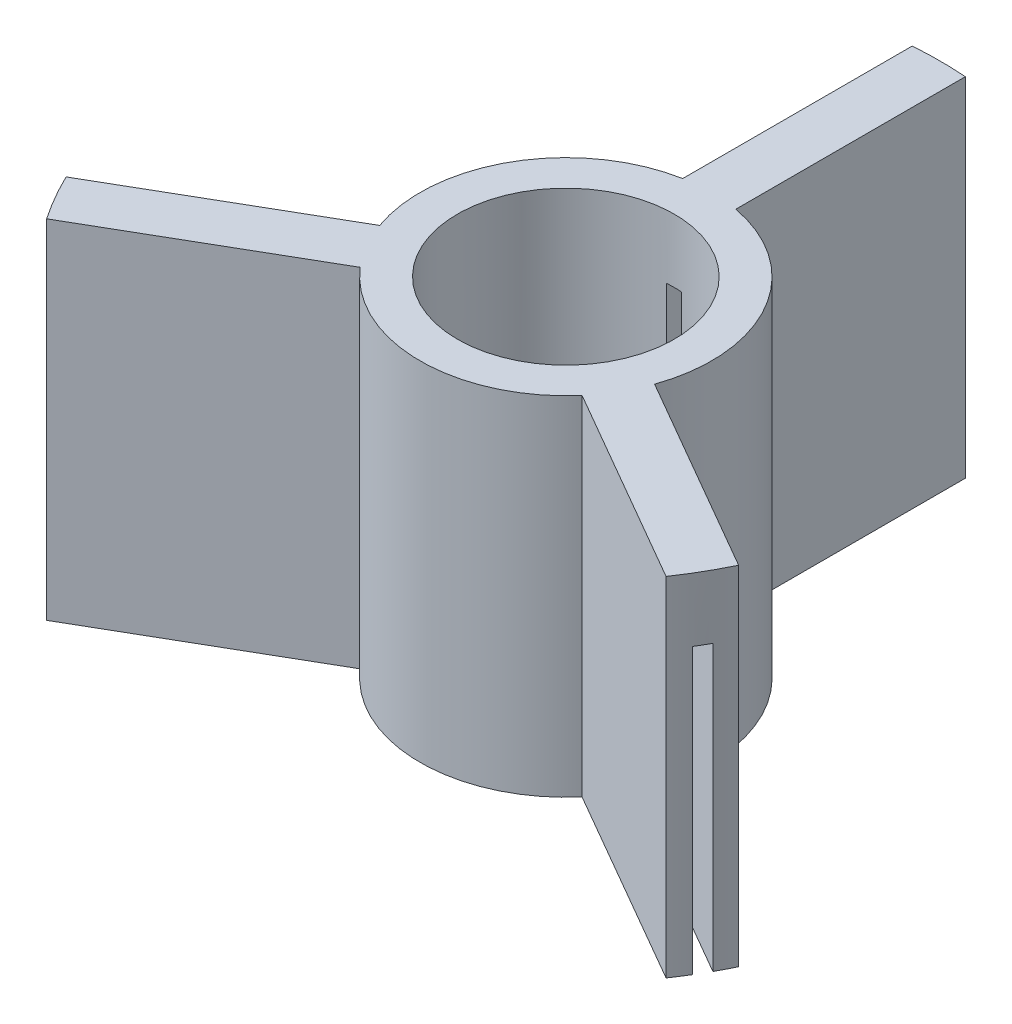
from build123d import *
from build123d.topology import SkipClean

# Parameters (mm, degrees)
BOSS_EXTRUDE1_DEPTH     = 93
SKETCH1_4_R             = 39
SKETCH1_4_R_2           = 29
EXTRUDE_THIN1_DEPTH     = 93
CUT_EXTRUDE_THIN1_DEPTH = 76


# Read off the part's stored shape, not the designer's step: Cut-Extrude-Thin1
with BuildPart() as part:
    # Sketch1 → Boss-Extrude1 (new body)
    with BuildSketch(Plane(origin=(0, 0, 0), x_dir=(1, 0, 0), z_dir=(0, 1, 0))):
        with BuildLine():
            Line((-86.602540378, -50), (-25.11473671, -14.5))
            ThreePointArc((-25.11473671, -14.5), (-26.712107385, -11.289965415), (-27.901144427, -7.907347195))
            Line((-27.901144427, -7.907347195), (-89.935126387, -43.722683378))
            ThreePointArc((-89.935126387, -43.722683378), (-88.324617875, -46.890957308), (-86.602540378, -50))
        make_face()
        with BuildLine():
            ThreePointArc((-20.798535761, -20.209426271), (-23.133450549, -17.488380876), (-25.11473671, -14.5))
            Line((-25.11473671, -14.5), (-86.602540378, -50))
            ThreePointArc((-86.602540378, -50), (-84.771069174, -53.045884205), (-82.83251772, -56.024762455))
            Line((-82.83251772, -56.024762455), (-20.798535761, -20.209426271))
        make_face()
        with BuildLine():
            ThreePointArc((27.901144427, -7.907347195), (26.712107385, -11.289965415), (25.11473671, -14.5))
            Line((25.11473671, -14.5), (86.602540378, -50))
            ThreePointArc((86.602540378, -50), (88.324617875, -46.890957308), (89.935126387, -43.722683378))
            Line((89.935126387, -43.722683378), (27.901144427, -7.907347195))
        make_face()
        with BuildLine():
            Line((86.602540378, -50), (25.11473671, -14.5))
            ThreePointArc((25.11473671, -14.5), (23.133450549, -17.488380876), (20.798535761, -20.209426271))
            Line((20.798535761, -20.209426271), (82.83251772, -56.024762455))
            ThreePointArc((82.83251772, -56.024762455), (84.771069174, -53.045884205), (86.602540378, -50))
        make_face()
        with BuildLine():
            ThreePointArc((-7.102608667, 28.116773466), (-3.578656835, 28.778346291), (0, 29))
            Line((0, 29), (0, 100))
            ThreePointArc((0, 100), (-3.553548701, 99.936841513), (-7.102608667, 99.747445833))
            Line((-7.102608667, 99.747445833), (-7.102608667, 28.116773466))
        make_face()
        with BuildLine():
            Line((0, 100), (0, 29))
            ThreePointArc((0, 29), (3.578656835, 28.778346291), (7.102608667, 28.116773466))
            Line((7.102608667, 28.116773466), (7.102608667, 99.747445833))
            ThreePointArc((7.102608667, 99.747445833), (3.553548701, 99.936841513), (0, 100))
        make_face()
    extrude(amount=BOSS_EXTRUDE1_DEPTH)

    # Sketch1<4> → Extrude-Thin1 (add)
    with SkipClean():  # the faces are left unmerged after this step: merging them gives an invalid solid
        with BuildSketch(Plane(origin=(0, 0, 0), x_dir=(1, 0, 0), z_dir=(0, 1, 0))):
            Circle(SKETCH1_4_R)
            Circle(SKETCH1_4_R_2, mode=Mode.SUBTRACT)
        extrude(amount=EXTRUDE_THIN1_DEPTH)

    # Cut-Extrude-Thin1 outline → Cut-Extrude-Thin1 (cut)
    with SkipClean():  # the faces are left unmerged after this step: merging them gives an invalid solid
        with BuildSketch(Plane(origin=(0, 0, 0), x_dir=(1, 0, 0), z_dir=(0, 1, 0))):
            with BuildLine():
                Line((2, 28.930952283), (2, 99.979998))
                ThreePointArc((2, 99.979998), (0, 100), (-2, 99.979998))
                Line((-2, 99.979998), (-2, 28.930952283))
                ThreePointArc((-2, 28.930952283), (0, 29), (2, 28.930952283))
            make_face()
            with BuildLine():
                Line((87.585218138, -48.257948192), (26.054939633, -12.733425334))
                ThreePointArc((26.054939633, -12.733425334), (25.11473671, -14.5), (24.054939633, -16.197526949))
                Line((24.054939633, -16.197526949), (85.585218138, -51.722049807))
                ThreePointArc((85.585218138, -51.722049807), (86.602540378, -50), (87.585218138, -48.257948192))
            make_face()
            with BuildLine():
                ThreePointArc((-24.054939633, -16.197526949), (-25.11473671, -14.5), (-26.054939633, -12.733425334))
                Line((-26.054939633, -12.733425334), (-87.585218138, -48.257948192))
                ThreePointArc((-87.585218138, -48.257948192), (-86.602540378, -50), (-85.585218138, -51.722049807))
                Line((-85.585218138, -51.722049807), (-24.054939633, -16.197526949))
            make_face()
        extrude(amount=CUT_EXTRUDE_THIN1_DEPTH, mode=Mode.SUBTRACT)


solid = part.part
